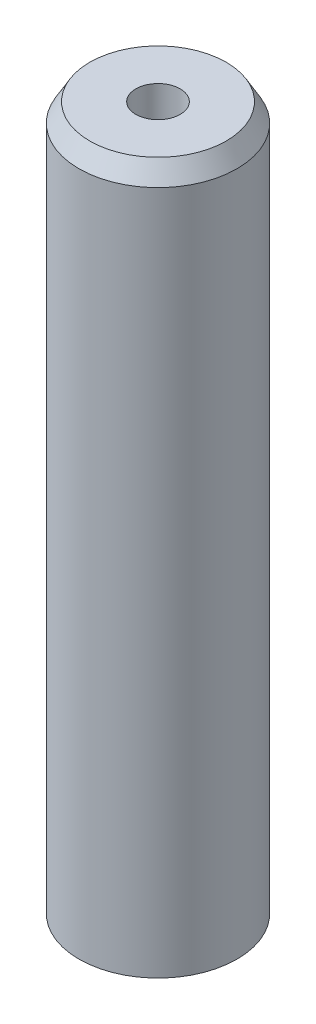
from build123d import *
from OCP.BRepFilletAPI import BRepFilletAPI_MakeChamfer

# Parameters (mm, degrees)
SKETCH1_R           = 10
BOSS_EXTRUDE1_DEPTH = 90.368731501
SKETCH2_R           = 2.80693543
CUT_EXTRUDE1_DEPTH  = 92.468615563
CHAMFER1_SIZE       = 2.360278834
CHAMFER1_SIZE2      = 1.36270762


with BuildPart() as part:
    # Sketch1 → Boss-Extrude1 (new body)
    with BuildSketch(Plane(origin=(0, 0, 0), x_dir=(1, 0, 0), z_dir=(0, 1, 0))):
        Circle(SKETCH1_R)
    extrude(amount=BOSS_EXTRUDE1_DEPTH)

    # Sketch2 → Cut-Extrude1 (cut, through all)
    with BuildSketch(Plane(origin=(0, 0, 0), x_dir=(1, 0, 0), z_dir=(0, 1, 0))):
        Circle(SKETCH2_R)
    extrude(amount=CUT_EXTRUDE1_DEPTH, mode=Mode.SUBTRACT)

    # Chamfer1: one chamfer whose edges measure the first distance from different faces: ONE call of the kernel's chamfer builder (chamfer() names one face for all edges)
    chamfer1_edges_1 = [part.edges().sort_by_distance(p)[0] for p in [
        (-10, 90.368731501, 0),
    ]]
    chamfer1_side_1 = [part.faces().sort_by_distance(p)[0] for p in [
        (-10, 45.18436575, 0),
    ]]
    chamfer1_edges_2 = [part.edges().sort_by_distance(p)[0] for p in [
        (-10, 0, 0),
    ]]
    chamfer1_side_2 = [part.faces().sort_by_distance(p)[0] for p in [
        (-9.717157288, 0, 0),
    ]]
    chamfer1 = BRepFilletAPI_MakeChamfer(part.part.solid().wrapped)
    for e in chamfer1_edges_1:
        chamfer1.Add(CHAMFER1_SIZE, CHAMFER1_SIZE2, e.wrapped, chamfer1_side_1[0].wrapped)  # the first distance lies on this face
    for e in chamfer1_edges_2:
        chamfer1.Add(CHAMFER1_SIZE, CHAMFER1_SIZE2, e.wrapped, chamfer1_side_2[0].wrapped)  # the first distance lies on this face
    add(Compound.cast(chamfer1.Shape()), mode=Mode.REPLACE)


solid = part.part
